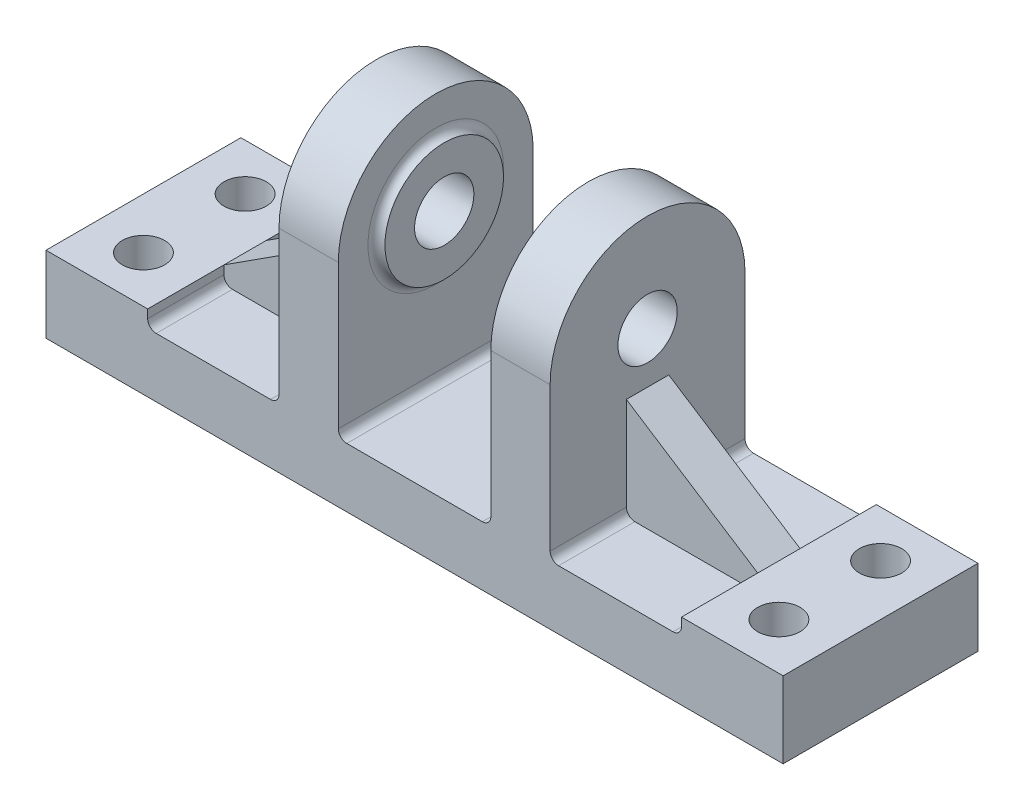
from build123d import *

# Parameters (mm, degrees)
SKETCH1_W                  = 174
SKETCH1_H                  = 18
BOSS_EXTRUDE1_DEPTH        = 46
SKETCH3_W                  = 126
SKETCH3_H                  = 46
CUT_EXTRUDE1_DEPTH         = 4
SKETCH4_R                  = 7
BOSS_EXTRUDE2_DEPTH        = 14
SKETCH5_R                  = 14
SKETCH5_R_2                = 7
BOSS_EXTRUDE3_DEPTH        = 2
RIB1_REACH                 = 162.545
SKETCH6_WALL_W             = 359.980893116
SKETCH6_WALL_H             = 10
FILLET1_R                  = 2
FILLET2_R                  = 2
FILLET3_R                  = 2
F_10_0_10_DIAMETER_HOLE5_D = 10


with BuildPart() as part:
    # Sketch1 → Boss-Extrude1 (new body)
    with BuildSketch(Plane.XY):
        with Locations((54.12605042, 9)):
            Rectangle(SKETCH1_W, SKETCH1_H)
    extrude(amount=-BOSS_EXTRUDE1_DEPTH)

    # Sketch3 → Cut-Extrude1 (cut)
    with BuildSketch(Plane(origin=(0, 18, 0), x_dir=(1, 0, 0), z_dir=(0, 1, 0))):
        with Locations((54.12605042, 23)):
            Rectangle(SKETCH3_W, SKETCH3_H)
    extrude(amount=-CUT_EXTRUDE1_DEPTH, mode=Mode.SUBTRACT)

    # Sketch4 → Boss-Extrude2 (add)
    with BuildSketch(Plane(origin=(86.12605042, 0, 0), x_dir=(0, 0, -1), z_dir=(1, 0, 0))):
        with BuildLine():
            Line((46, 14), (0, 14))
            Line((0, 14), (0, 50))
            ThreePointArc((0, 50), (23, 73), (46, 50))
            Line((46, 50), (46, 14))
        make_face()
        with Locations((23, 50)):
            Circle(SKETCH4_R, mode=Mode.SUBTRACT)
    extrude(amount=-BOSS_EXTRUDE2_DEPTH)

    # Sketch5 → Boss-Extrude3 (add)
    with BuildSketch(Plane.ZY.offset(-72.12605042)):
        with Locations((-23, 50)):
            Circle(SKETCH5_R)
        with Locations(Location((-23, 50, 0), (0, 0, 180))):
            Circle(SKETCH5_R_2, mode=Mode.SUBTRACT)
    extrude(amount=BOSS_EXTRUDE3_DEPTH)

    # Sketch6 wall → Rib1 (add, up to next)
    with BuildSketch(Plane(origin=(101.62605042, 28, -23), x_dir=(-0.840296648224, 0.542126869822, 0), z_dir=(-0.542126869822, -0.840296648224, 0)), mode=Mode.PRIVATE) as rib1_sk1:
        Rectangle(SKETCH6_WALL_W, SKETCH6_WALL_H)
    rib1_tool1 = extrude(rib1_sk1.sketch, amount=RIB1_REACH, mode=Mode.PRIVATE) - part.part
    add(rib1_tool1.solids().sort_by_distance((101.62605042, 28, -23))[0])

    # Mirror4: part across plane


with BuildPart() as part_1:
    add(part.part)
    add(part.part.mirror(Plane(origin=(54.12605042, 0, 0), x_dir=(0, 0, 1), z_dir=(1, 0, 0))))

    # Fillet1
    fillet1_edges = [part_1.edges().sort_by_distance(p)[0] for p in [
        (-8.87394958, 14, -9),
        (22.12605042, 14, -37),
        (36.12605042, 14, -23),
        (22.12605042, 14, -9),
        (-8.87394958, 14, -37),
        (117.12605042, 14, -9),
        (72.12605042, 14, -23),
        (86.12605042, 14, -9),
        (86.12605042, 14, -37),
        (117.12605042, 14, -37),
    ]]
    fillet(fillet1_edges, radius=FILLET1_R)

    # Fillet2
    fillet2_edges = [part_1.edges().sort_by_distance(p)[0] for p in [
        (36.12605042, 50, -37),
    ]]
    fillet(fillet2_edges, radius=FILLET2_R - 0.0001)  # a hair under: the kernel refuses the full size

    # Fillet3
    fillet3_edges = [part_1.edges().sort_by_distance(p)[0] for p in [
        (72.12605042, 50, -37),
    ]]
    fillet(fillet3_edges, radius=FILLET3_R - 0.0001)  # a hair under: the kernel refuses the full size

    # Ø10.0 (10) Diameter Hole5 (through all)
    with Locations(Plane(origin=(0, 18, 0), x_dir=(1, 0, 0), z_dir=(0, 1, 0))):
        with Locations((-20.87394958, 35), (-20.87394958, 11), (129.12605042, 35), (129.12605042, 11)):
            Hole(F_10_0_10_DIAMETER_HOLE5_D / 2)


solid = part_1.part
